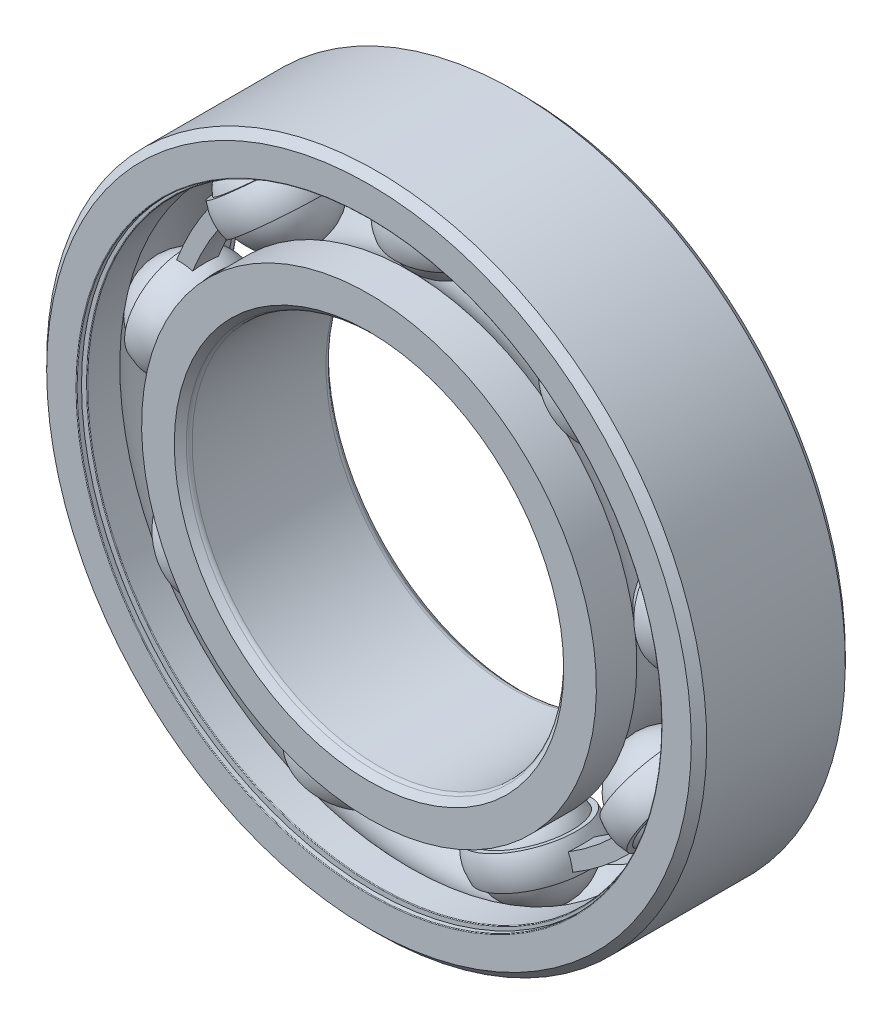
from build123d import *

# Parameters (mm, degrees)
BOSS_EXTRUDE1_DEPTH = 0.583333333
CIRPATTERN1_COUNT   = 9
CIRPATTERN2_COUNT   = 9
FILLET1_R           = 0.0315
FILLET2_R           = 0.2625


with BuildPart() as part:
    # Sketch3 → Revolve1 (revolve)
    with BuildSketch(Plane(origin=(0, 0, 0), x_dir=(0, 0, -1), z_dir=(1, 0, 0))):
        with BuildLine():
            Line((3.15, 15), (3.5, 14.65))
            Line((3.5, 14.65), (3.5, 13.165384615))
            Line((3.5, 13.165384615), (1.6625, 13.165384615))
            ThreePointArc((1.6625, 13.165384615), (0, 13.933396405), (-1.6625, 13.165384615))
            Line((-1.6625, 13.165384615), (-3.5, 13.165384615))
            Line((-3.5, 13.165384615), (-3.5, 14.65))
            Line((-3.5, 14.65), (-3.15, 15))
            Line((-3.15, 15), (3.15, 15))
        make_face()
    revolve(axis=Axis((0, 0, 3.5), (0, 0, -1)))

    # Sketch8 → Cut-Revolve1 (revolve, cut)
    with BuildSketch(Plane(origin=(0, 0, 0), x_dir=(0, 0, -1), z_dir=(1, 0, 0))):
        Polygon((-3.276, 13.165384615), (-3.15, 13.165384615), (-3.15, 13.776923077), (-3.276, 13.776923077), (-3.276, 13.291384615), (-3.5, 13.291384615), (-3.5, 13.165384615), align=None)
        Polygon((3.15, 13.165384615), (3.276, 13.165384615), (3.5, 13.165384615), (3.5, 13.291384615), (3.276, 13.291384615), (3.276, 13.776923077), (3.15, 13.776923077), align=None)
    revolve(axis=Axis((0, 0, 3.5), (0, 0, -1)), mode=Mode.SUBTRACT)

    # Fillet1
    fillet1_edges = [part.edges().sort_by_distance(p)[0] for p in [
        (0, -13.165384615, -3.15),
        (0, -13.291384615, -3.5),
        (0, -13.165384615, 3.15),
        (0, -13.291384615, 3.5),
    ]]
    fillet(fillet1_edges, radius=FILLET1_R)


with BuildPart() as body_2:
    # Sketch4 → Revolve2 (revolve)
    with BuildSketch(Plane(origin=(0, 0, 0), x_dir=(0, 0, -1), z_dir=(1, 0, 0))):
        with BuildLine():
            Line((-3.15, 8.5), (-3.5, 8.85))
            Line((-3.5, 8.85), (-3.5, 10.334615385))
            Line((-3.5, 10.334615385), (-1.6625, 10.334615385))
            ThreePointArc((-1.6625, 10.334615385), (0, 9.566603595), (1.6625, 10.334615385))
            Line((1.6625, 10.334615385), (3.5, 10.334615385))
            Line((3.5, 10.334615385), (3.5, 8.85))
            Line((3.5, 8.85), (3.15, 8.5))
            Line((3.15, 8.5), (-3.15, 8.5))
        make_face()
    revolve(axis=Axis((0, 0, 3.5), (0, 0, -1)))

    # Fillet2
    fillet2_edges = [body_2.edges().sort_by_distance(p)[0] for p in [
        (0, -8.5, -3.15),
        (0, -8.5, 3.15),
    ]]
    fillet(fillet2_edges, radius=FILLET2_R)


with BuildPart() as body_3:
    # Sketch5 → Revolve3 (revolve)
    with BuildSketch(Plane(origin=(0, 0, 0), x_dir=(0, 0, -1), z_dir=(1, 0, 0))):
        with BuildLine():
            Line((-2.183396405, 11.75), (2.183396405, 11.75))
            ThreePointArc((2.183396405, 11.75), (0, 13.933396405), (-2.183396405, 11.75))
        make_face()
    revolve(axis=Axis((0, 11.75, 2.183396405), (0, 0, -1)))


with BuildPart() as body_4:
    # Sketch6 → Revolve4 (revolve)
    with BuildSketch(Plane(origin=(0, 0, 0), x_dir=(0, 0, -1), z_dir=(1, 0, 0))):
        with BuildLine():
            Line((-2.065524499, 12.457692308), (-2.304603749, 12.457692308))
            ThreePointArc((-2.304603749, 12.457692308), (-2.424143374, 11.75), (-2.304603749, 11.042307692))
            Line((-2.304603749, 11.042307692), (-2.065524499, 11.042307692))
            ThreePointArc((-2.065524499, 11.042307692), (-2.183396405, 11.75), (-2.065524499, 12.457692308))
        make_face()
    revolve4 = revolve(axis=Axis((0, 15, 0), (0, -1, 0)))

    # Sketch7 → Boss-Extrude1 (add, symmetric)
    with BuildSketch(Plane.XY):
        with BuildLine():
            Line((7.552754414, 9.001022207), (8.007650261, 9.543145966))
            ThreePointArc((8.007650261, 9.543145966), (4.260781709, 11.706401534), (0, 12.457692308))
            Line((0, 12.457692308), (0, 11.75))
            ThreePointArc((0, 11.75), (4.018736684, 11.041388294), (7.552754414, 9.001022207))
        make_face()
    boss_extrude1 = extrude(amount=BOSS_EXTRUDE1_DEPTH, both=True)

    # CirPattern2: Revolve4, Boss-Extrude1 ×9 about axis
    cirpattern2_axis = Axis((0, 0, 3.5), (0, 0, -1))
    add([revolve4.rotate(cirpattern2_axis, i * 360 / CIRPATTERN2_COUNT) for i in range(1, CIRPATTERN2_COUNT)])
    add([boss_extrude1.rotate(cirpattern2_axis, i * 360 / CIRPATTERN2_COUNT) for i in range(1, CIRPATTERN2_COUNT)])


with BuildPart() as cirpattern1_1:
    # CirPattern1: pattern copy
    add(body_3.part.rotate(Axis((0, 0, 3.5), (0, 0, -1)), 1 * 360 / CIRPATTERN1_COUNT))


with BuildPart() as cirpattern1_2:
    # CirPattern1: pattern copy
    add(body_3.part.rotate(Axis((0, 0, 3.5), (0, 0, -1)), 2 * 360 / CIRPATTERN1_COUNT))


with BuildPart() as cirpattern1_3:
    # CirPattern1: pattern copy
    add(body_3.part.rotate(Axis((0, 0, 3.5), (0, 0, -1)), 3 * 360 / CIRPATTERN1_COUNT))


with BuildPart() as cirpattern1_4:
    # CirPattern1: pattern copy
    add(body_3.part.rotate(Axis((0, 0, 3.5), (0, 0, -1)), 4 * 360 / CIRPATTERN1_COUNT))


with BuildPart() as cirpattern1_5:
    # CirPattern1: pattern copy
    add(body_3.part.rotate(Axis((0, 0, 3.5), (0, 0, -1)), 5 * 360 / CIRPATTERN1_COUNT))


with BuildPart() as cirpattern1_6:
    # CirPattern1: pattern copy
    add(body_3.part.rotate(Axis((0, 0, 3.5), (0, 0, -1)), 6 * 360 / CIRPATTERN1_COUNT))


with BuildPart() as cirpattern1_7:
    # CirPattern1: pattern copy
    add(body_3.part.rotate(Axis((0, 0, 3.5), (0, 0, -1)), 7 * 360 / CIRPATTERN1_COUNT))


with BuildPart() as cirpattern1_8:
    # CirPattern1: pattern copy
    add(body_3.part.rotate(Axis((0, 0, 3.5), (0, 0, -1)), 8 * 360 / CIRPATTERN1_COUNT))


solid = Compound([part.part, body_2.part, body_3.part, body_4.part, cirpattern1_1.part, cirpattern1_2.part, cirpattern1_3.part, cirpattern1_4.part, cirpattern1_5.part, cirpattern1_6.part, cirpattern1_7.part, cirpattern1_8.part])
